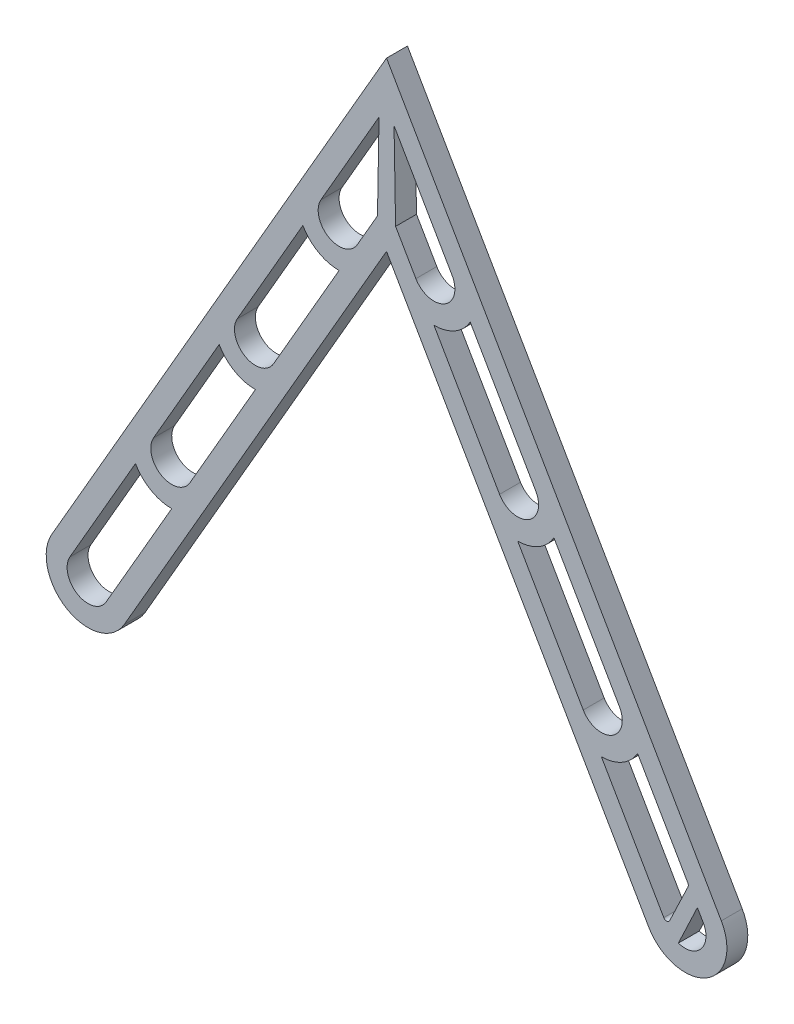
from build123d import *

# Parameters (mm, degrees)
BOSS_EXTRUDE1_DEPTH = 3.175
FILLET3_R           = 0.5


with BuildPart() as part:
    # Sketch1 → Boss-Extrude1 (new body)
    with BuildSketch(Plane.XY):
        with BuildLine():
            Line((0, 0), (-50.8, -87.988181024))
            ThreePointArc((-50.8, -87.988181024), (-48.475738686, -96.662442339), (-39.801477372, -94.338181024))
            Line((-39.801477372, -94.338181024), (0, -25.4))
            Line((0, -25.4), (39.801477372, -94.338181024))
            ThreePointArc((39.801477372, -94.338181024), (48.475738686, -96.662442339), (50.8, -87.988181024))
            Line((50.8, -87.988181024), (0, 0))
        make_face()
        with BuildLine():
            Line((-1.139014765, -8.322831444), (-9.950369343, -23.584545256))
            ThreePointArc((-9.950369343, -23.584545256), (-8.788238686, -27.921675913), (-4.451108029, -26.759545256))
            Line((-4.451108029, -26.759545256), (-2.749630657, -23.8125))
            Line((-2.749630657, -23.8125), (-1.374815329, -21.43125))
            Line((-1.374815329, -21.43125), (-1.139014765, -8.322831444))
        make_face(mode=Mode.SUBTRACT)
        with BuildLine():
            Line((-38.1, -72.341135768), (-48.050369343, -89.575681024))
            ThreePointArc((-48.050369343, -89.575681024), (-46.888238686, -93.912811682), (-42.551108029, -92.750681024))
            Line((-42.551108029, -92.750681024), (-32.600738686, -75.516135768))
            ThreePointArc((-32.600738686, -75.516135768), (-35.775738686, -74.665397082), (-38.1, -72.341135768))
        make_face(mode=Mode.SUBTRACT)
        with BuildLine():
            Line((-19.900738686, -53.519090512), (-29.851108029, -70.753635768))
            ThreePointArc((-29.851108029, -70.753635768), (-34.188238686, -71.915766425), (-35.350369343, -67.578635768))
            Line((-35.350369343, -67.578635768), (-25.4, -50.344090512))
            ThreePointArc((-25.4, -50.344090512), (-23.075738686, -52.668351826), (-19.900738686, -53.519090512))
        make_face(mode=Mode.SUBTRACT)
        with BuildLine():
            Line((-7.200738686, -31.522045256), (-17.151108029, -48.756590512))
            ThreePointArc((-17.151108029, -48.756590512), (-21.488238686, -49.918721169), (-22.650369343, -45.581590512))
            Line((-22.650369343, -45.581590512), (-12.7, -28.347045256))
            ThreePointArc((-12.7, -28.347045256), (-10.375738686, -30.67130657), (-7.200738686, -31.522045256))
        make_face(mode=Mode.SUBTRACT)
        with BuildLine():
            Line((2.749630657, -23.8125), (1.374815329, -21.43125))
            Line((1.374815329, -21.43125), (1.139014765, -8.322831444))
            Line((1.139014765, -8.322831444), (9.950369343, -23.584545256))
            ThreePointArc((9.950369343, -23.584545256), (8.788238686, -27.921675913), (4.451108029, -26.759545256))
            Line((4.451108029, -26.759545256), (2.749630657, -23.8125))
        make_face(mode=Mode.SUBTRACT)
        with BuildLine():
            Line((12.7, -28.347045256), (22.650369343, -45.581590512))
            ThreePointArc((22.650369343, -45.581590512), (21.488238686, -49.918721169), (17.151108029, -48.756590512))
            Line((17.151108029, -48.756590512), (7.200738686, -31.522045256))
            ThreePointArc((7.200738686, -31.522045256), (10.375738686, -30.67130657), (12.7, -28.347045256))
        make_face(mode=Mode.SUBTRACT)
        with BuildLine():
            Line((25.4, -50.344090512), (35.350369343, -67.578635768))
            ThreePointArc((35.350369343, -67.578635768), (34.188238686, -71.915766425), (29.851108029, -70.753635768))
            Line((29.851108029, -70.753635768), (19.900738686, -53.519090512))
            ThreePointArc((19.900738686, -53.519090512), (23.075738686, -52.668351826), (25.4, -50.344090512))
        make_face(mode=Mode.SUBTRACT)
        with BuildLine():
            Line((32.600738686, -75.516135768), (42.551108029, -92.750681024))
            Line((42.551108029, -92.750681024), (45.867728895, -85.795236874))
            Line((45.867728895, -85.795236874), (38.1, -72.341135768))
            ThreePointArc((38.1, -72.341135768), (35.775738686, -74.665397082), (32.600738686, -75.516135768))
        make_face(mode=Mode.SUBTRACT)
        with BuildLine():
            Line((47.174213443, -88.058134491), (48.050369343, -89.575681024))
            ThreePointArc((48.050369343, -89.575681024), (47.757408354, -93.174498787), (44.287225977, -94.172070685))
            Line((44.287225977, -94.172070685), (44.336088039, -94.068592739))
            Line((44.336088039, -94.068592739), (47.092670891, -88.230821754))
            Line((47.092670891, -88.230821754), (47.174213443, -88.058134491))
        make_face(mode=Mode.SUBTRACT)
    extrude(amount=BOSS_EXTRUDE1_DEPTH)

    # Fillet3
    fillet3_edges = [part.edges().sort_by_distance(p)[0] for p in [
        (42.551108029, -92.750681024, 1.5875),
        (45.867728895, -85.795236874, 1.5875),
    ]]
    fillet(fillet3_edges, radius=FILLET3_R)


solid = part.part
